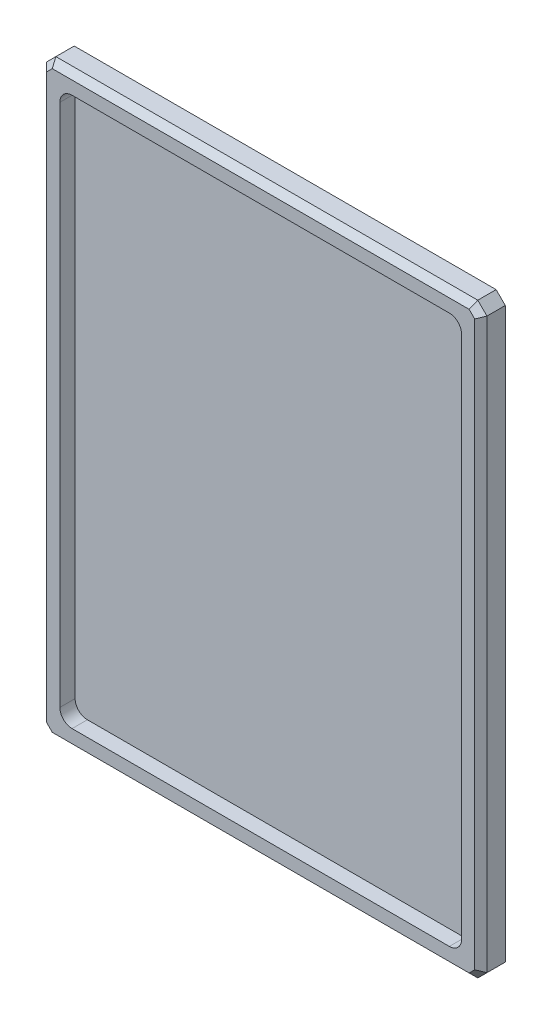
from build123d import *

# Parameters (mm, degrees)
SKETCH1_W           = 228.6
SKETCH1_H           = 304.8
BOSS_EXTRUDE1_DEPTH = 12.7
CUT_EXTRUDE1_DEPTH  = 7.9375
CHAMFER1_SIZE       = 4.7625
CHAMFER2_SIZE       = 3.175


with BuildPart() as part:
    # Sketch1 → Boss-Extrude1 (new body)
    with BuildSketch(Plane.XY):
        Rectangle(SKETCH1_W, SKETCH1_H)
    extrude(amount=BOSS_EXTRUDE1_DEPTH)

    # Sketch2 → Cut-Extrude1 (cut)
    with BuildSketch(Plane.XY.offset(12.7)):
        with BuildLine():
            Line((97.95, -142.4), (-97.95, -142.4))
            ThreePointArc((-97.95, -142.4), (-102.440128061, -140.540128061), (-104.3, -136.05))
            Line((-104.3, -136.05), (-104.3, 136.05))
            ThreePointArc((-104.3, 136.05), (-102.440128061, 140.540128061), (-97.95, 142.4))
            Line((-97.95, 142.4), (97.95, 142.4))
            ThreePointArc((97.95, 142.4), (102.440128061, 140.540128061), (104.3, 136.05))
            Line((104.3, 136.05), (104.3, -136.05))
            ThreePointArc((104.3, -136.05), (102.440128061, -140.540128061), (97.95, -142.4))
        make_face()
    extrude(amount=-CUT_EXTRUDE1_DEPTH, mode=Mode.SUBTRACT)

    # Chamfer1
    chamfer1_edges = [part.edges().sort_by_distance(p)[0] for p in [
        (-114.3, -152.4, 6.35),
        (114.3, -152.4, 6.35),
        (-114.3, 152.4, 6.35),
        (114.3, 152.4, 6.35),
    ]]
    chamfer(chamfer1_edges, length=CHAMFER1_SIZE)

    # Chamfer2
    chamfer2_edges = [part.edges().sort_by_distance(p)[0] for p in [
        (-111.91875, 150.01875, 12.7),
        (0, 152.4, 12.7),
        (-114.3, 0, 12.7),
        (-111.91875, -150.01875, 12.7),
        (0, -152.4, 12.7),
        (111.91875, -150.01875, 12.7),
        (114.3, 0, 12.7),
        (111.91875, 150.01875, 12.7),
    ]]
    chamfer(chamfer2_edges, length=CHAMFER2_SIZE)


solid = part.part
